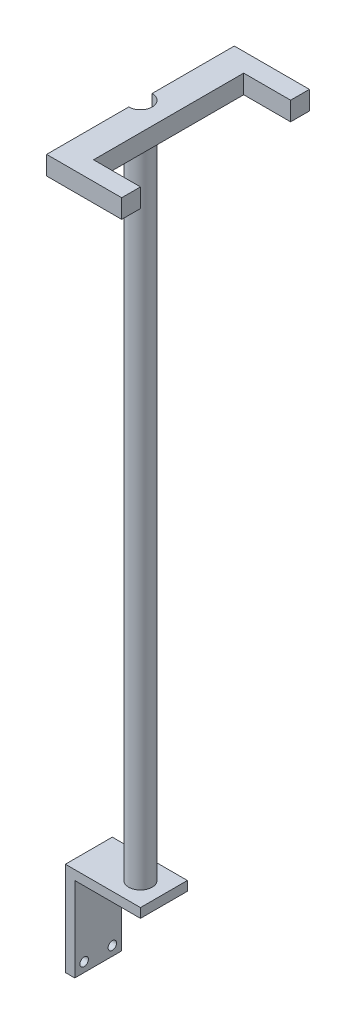
from build123d import *

# Parameters (mm, degrees)
SZKIC1_W                    = 50
SZKIC1_H                    = 100
SZKIC1_R                    = 4.5
DODANIE_WYCI_GNI_CIE1_DEPTH = 10
SZKIC2_W                    = 80
SZKIC2_H                    = 10
DODANIE_WYCI_GNI_CIE2_DEPTH = 50
SZKIC3_R                    = 12.5
DODANIE_WYCI_GNI_CIE3_DEPTH = 700
DODANIE_WYCI_GNI_CIE4_DEPTH = 20


with BuildPart() as part:
    # Szkic1 → Dodanie-wyciągnięcie1 (new body)
    with BuildSketch(Plane(origin=(0, 0, 0), x_dir=(0, 0, -1), z_dir=(1, 0, 0))):
        with Locations((25, 50)):
            Rectangle(SZKIC1_W, SZKIC1_H)
        with Locations((10, 10)):
            Circle(SZKIC1_R, mode=Mode.SUBTRACT)
        with Locations((40, 10)):
            Circle(SZKIC1_R, mode=Mode.SUBTRACT)
    extrude(amount=DODANIE_WYCI_GNI_CIE1_DEPTH)

    # Szkic2 → Dodanie-wyciągnięcie2 (add)
    with BuildSketch(Plane(origin=(0, 0, -50), x_dir=(-1, 0, 0), z_dir=(0, 0, -1))):
        with Locations((-40, 95)):
            Rectangle(SZKIC2_W, SZKIC2_H)
    extrude(amount=-DODANIE_WYCI_GNI_CIE2_DEPTH)

    # Szkic3 → Dodanie-wyciągnięcie3 (add)
    with BuildSketch(Plane(origin=(0, 100, 0), x_dir=(1, 0, 0), z_dir=(0, 1, 0))):
        with Locations((55, 25)):
            Circle(SZKIC3_R)
    extrude(amount=DODANIE_WYCI_GNI_CIE3_DEPTH)


with BuildPart() as body_2:
    # Szkic4 → Dodanie-wyciągnięcie4 (new body)
    with BuildSketch(Plane(origin=(0, 800, 0), x_dir=(1, 0, 0), z_dir=(0, 1, 0))):
        with BuildLine():
            Line((135, 125), (55, 125))
            Line((55, 125), (55, 37.5))
            ThreePointArc((55, 37.5), (63.838834765, 33.838834765), (67.5, 25))
            ThreePointArc((67.5, 25), (63.838834765, 16.161165235), (55, 12.5))
            Line((55, 12.5), (55, -75))
            Line((55, -75), (135, -75))
            Line((135, -75), (135, -55))
            Line((135, -55), (85, -55))
            Line((85, -55), (85, 105))
            Line((85, 105), (135, 105))
            Line((135, 105), (135, 125))
        make_face()
    extrude(amount=DODANIE_WYCI_GNI_CIE4_DEPTH)


solid = Compound([part.part, body_2.part])
